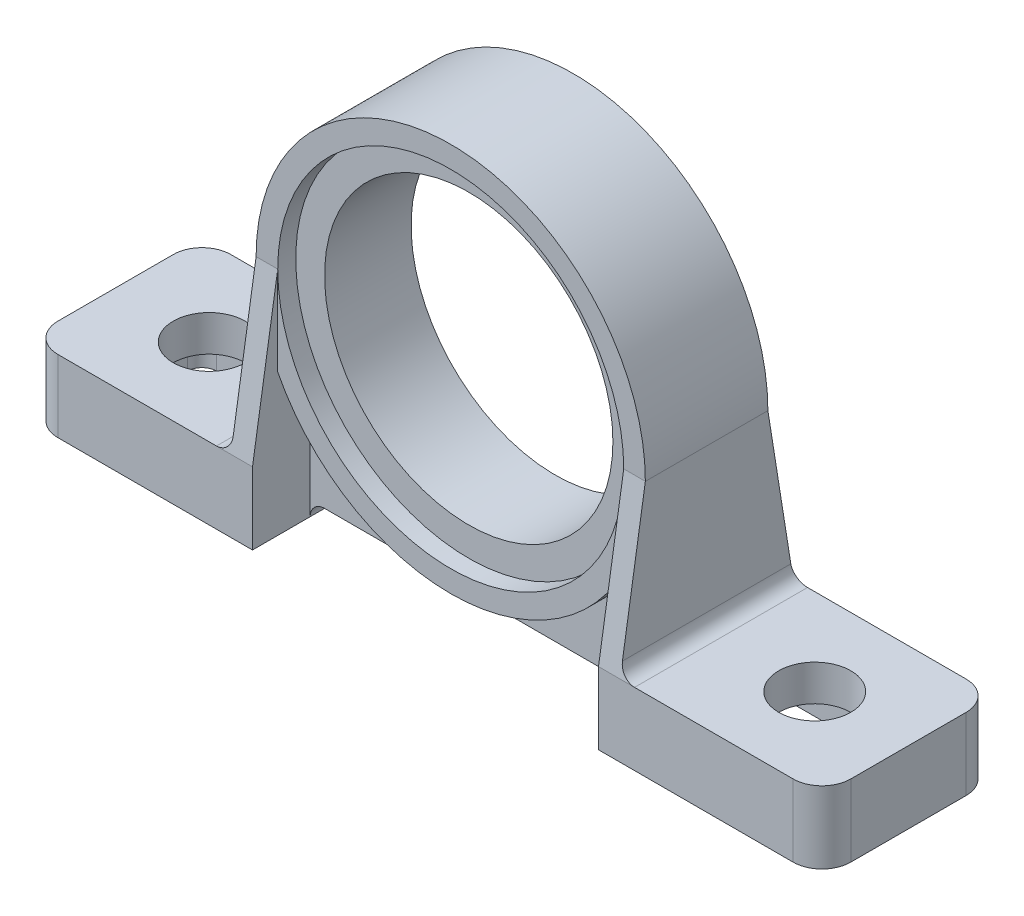
from build123d import *

# Parameters (mm, degrees)
SKETCH1_R           = 10
BOSS_EXTRUDE1_DEPTH = 12
CUT_EXTRUDE1_DEPTH  = 59.523499554
CUT_EXTRUDE2_START  = 8
CUT_EXTRUDE2_DEPTH  = 4
CUT_EXTRUDE3_DEPTH  = 4
BOSS_EXTRUDE2_START = 6
SKETCH4_R           = 13.5
SKETCH4_R_2         = 12
BOSS_EXTRUDE2_DEPTH = 4.25
SKETCH6_R           = 12
SKETCH6_R_2         = 10
CUT_EXTRUDE4_DEPTH  = 3
CUT_EXTRUDE5_START  = 9
SKETCH6_2_R         = 12
SKETCH6_2_R_2       = 10
CUT_EXTRUDE5_DEPTH  = 3
SKETCH7_R           = 2.5
CUT_EXTRUDE6_DEPTH  = 5
SKETCH8_W           = 10
SKETCH8_H           = 7
CUT_EXTRUDE7_DEPTH  = 2.5
SKETCH9_W           = 24
SKETCH9_H           = 4
CUT_EXTRUDE8_DEPTH  = 1
FILLET1_R           = 1
FILLET2_R           = 2
FILLET3_R           = 1


with BuildPart() as part:
    # Sketch1 → Boss-Extrude1 (new body)
    with BuildSketch(Plane.XY):
        with BuildLine():
            Line((27.5, -16), (-27.5, -16))
            Line((-27.5, -16), (-27.5, -11))
            Line((-27.5, -11), (-13.5, -11))
            Line((-13.5, -11), (-13.5, 0))
            ThreePointArc((-13.5, 0), (0, 13.5), (13.5, 0))
            Line((13.5, 0), (13.5, -11))
            Line((13.5, -11), (27.5, -11))
            Line((27.5, -11), (27.5, -16))
        make_face()
        Circle(SKETCH1_R, mode=Mode.SUBTRACT)
    extrude(amount=BOSS_EXTRUDE1_DEPTH)

    # Sketch2 → Cut-Extrude1 (cut, through all)
    with BuildSketch(Plane.ZY.offset(27.5)):
        Polygon((10.25, 0), (12, -11), (12, 13.5), (10.25, 13.5), align=None)
        Polygon((0, -11), (1.75, 0), (1.75, 13.5), (0, 13.5), align=None)
    extrude(amount=-CUT_EXTRUDE1_DEPTH, mode=Mode.SUBTRACT)

    # Sketch3 → Cut-Extrude2 (cut)
    with BuildSketch(Plane.XY.offset(CUT_EXTRUDE2_START)):
        with BuildLine():
            ThreePointArc((12, 0), (0, -12), (-12, 0))
            Line((-12, 0), (-12, -16))
            Line((-12, -16), (12, -16))
            Line((12, -16), (12, 0))
        make_face()
    extrude(amount=CUT_EXTRUDE2_DEPTH, mode=Mode.SUBTRACT)

    # Sketch3<3> → Cut-Extrude3 (cut)
    with BuildSketch(Plane.XY):
        with BuildLine():
            ThreePointArc((12, 0), (0, -12), (-12, 0))
            Line((-12, 0), (-12, -16))
            Line((-12, -16), (12, -16))
            Line((12, -16), (12, 0))
        make_face()
    extrude(amount=CUT_EXTRUDE3_DEPTH, mode=Mode.SUBTRACT)

    # Sketch4 → Boss-Extrude2 (add, symmetric)
    with BuildSketch(Plane.XY.offset(BOSS_EXTRUDE2_START)):
        Circle(SKETCH4_R)
        Circle(SKETCH4_R_2, mode=Mode.SUBTRACT)
    extrude(amount=BOSS_EXTRUDE2_DEPTH, both=True)

    # Sketch6 → Cut-Extrude4 (cut)
    with BuildSketch(Plane.XY):
        Circle(SKETCH6_R)
        Circle(SKETCH6_R_2, mode=Mode.SUBTRACT)
    extrude(amount=CUT_EXTRUDE4_DEPTH, mode=Mode.SUBTRACT)

    # Sketch6<2> → Cut-Extrude5 (cut)
    with BuildSketch(Plane.XY.offset(CUT_EXTRUDE5_START)):
        Circle(SKETCH6_2_R)
        Circle(SKETCH6_2_R_2, mode=Mode.SUBTRACT)
    extrude(amount=CUT_EXTRUDE5_DEPTH, mode=Mode.SUBTRACT)

    # Sketch7 → Cut-Extrude6 (cut)
    with BuildSketch(Plane.XZ.offset(16)):
        with Locations((-21, 6)):
            Circle(SKETCH7_R)
        with Locations((21, 6)):
            Circle(SKETCH7_R)
    extrude(amount=-CUT_EXTRUDE6_DEPTH, mode=Mode.SUBTRACT)

    # Sketch8 → Cut-Extrude7 (cut)
    with BuildSketch(Plane.XZ.offset(16)):
        with Locations((20, 6)):
            Rectangle(SKETCH8_W, SKETCH8_H)
        with Locations((-20, 6)):
            Rectangle(SKETCH8_W, SKETCH8_H)
    extrude(amount=-CUT_EXTRUDE7_DEPTH, mode=Mode.SUBTRACT)

    # Sketch9 → Cut-Extrude8 (cut)
    with BuildSketch(Plane.XZ.offset(16)):
        with Locations((0, 6)):
            Rectangle(SKETCH9_W, SKETCH9_H)
    extrude(amount=-CUT_EXTRUDE8_DEPTH, mode=Mode.SUBTRACT)

    # Fillet1
    fillet1_edges = [part.edges().sort_by_distance(p)[0] for p in [
        (13.5, -11, 6),
        (-13.5, -11, 6),
        (12, -15, 6),
        (-12, -15, 6),
    ]]
    fillet(fillet1_edges, radius=FILLET1_R - 0.0001)  # a hair under: the kernel refuses the full size

    # Fillet2
    fillet2_edges = [part.edges().sort_by_distance(p)[0] for p in [
        (-27.5, -13.5, 0),
        (-27.5, -13.5, 12),
        (27.5, -13.5, 12),
        (27.5, -13.5, 0),
    ]]
    fillet(fillet2_edges, radius=FILLET2_R)

    # Fillet3
    fillet3_edges = [part.edges().sort_by_distance(p)[0] for p in [
        (-25, -14.75, 9.5),
        (-15, -14.75, 9.5),
        (-15, -14.75, 2.5),
        (-25, -14.75, 2.5),
        (25, -14.75, 9.5),
        (25, -14.75, 2.5),
        (15, -14.75, 2.5),
        (15, -14.75, 9.5),
    ]]
    fillet(fillet3_edges, radius=FILLET3_R)


solid = part.part
